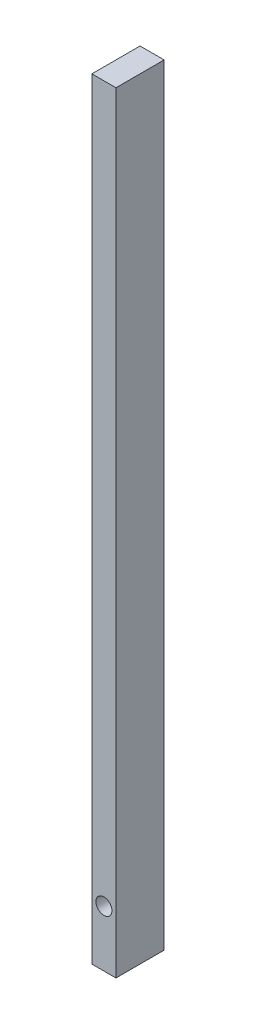
from build123d import *

# Parameters (mm, degrees)
SKETCH1_W           = 38.1
SKETCH1_H           = 609.6
BOSS_EXTRUDE1_DEPTH = 19.05
SKETCH2_R           = 4.7625
CUT_EXTRUDE1_DEPTH  = 308.762168728
SKETCH3_R           = 6.35
CUT_EXTRUDE2_DEPTH  = 19.431
SKETCH6_R           = 0.762
CUT_EXTRUDE5_DEPTH  = 12.7


with BuildPart() as part:
    # Sketch1 → Boss-Extrude1 (new body)
    with BuildSketch(Plane(origin=(0, 0, 0), x_dir=(0, 0, -1), z_dir=(1, 0, 0))):
        Rectangle(SKETCH1_W, SKETCH1_H)
    extrude(amount=BOSS_EXTRUDE1_DEPTH)

    # Sketch2 → Cut-Extrude1 (cut, through all)
    with BuildSketch(Plane.XY.offset(19.05)):
        with Locations((9.525, -260.35)):
            Circle(SKETCH2_R)
    extrude(amount=-CUT_EXTRUDE1_DEPTH, mode=Mode.SUBTRACT)

    # Sketch3 → Cut-Extrude2 (cut)
    with BuildSketch(Plane.XY.offset(19.05)):
        with Locations((9.525, -260.35)):
            Circle(SKETCH3_R)
    extrude(amount=-CUT_EXTRUDE2_DEPTH, mode=Mode.SUBTRACT)

    # Sketch6 → Cut-Extrude5 (cut)
    with BuildSketch(Plane(origin=(0, 0, -19.05), x_dir=(-1, 0, 0), z_dir=(0, 0, -1))):
        with Locations((-9.525, -248.031)):
            Circle(SKETCH6_R)
    extrude(amount=-CUT_EXTRUDE5_DEPTH, mode=Mode.SUBTRACT)


solid = part.part
